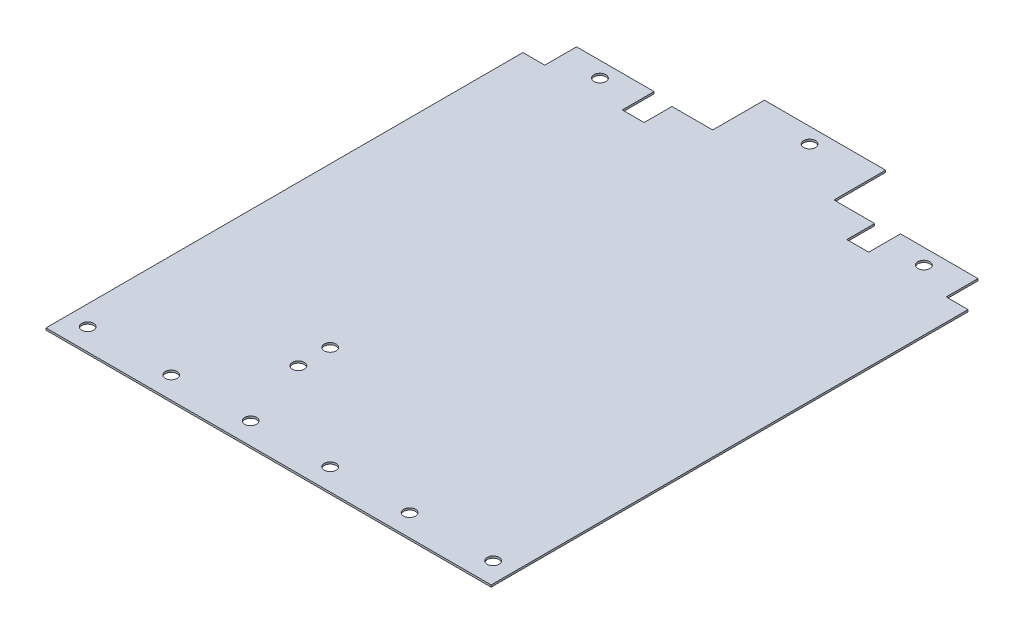
from build123d import *

# Parameters (mm, degrees)
CROQUIS1_W            = 112
CROQUIS1_H            = 140
BRIDA_BASE1_DEPTH     = 0.5
CORTAR_EXTRUIR1_DEPTH = 10
CROQUIS6_R            = 1.5
CORTAR_EXTRUIR2_DEPTH = 10
CROQUIS7_R            = 1.5
CORTAR_EXTRUIR3_DEPTH = 10


# Sheet-metal steps are written as plain solids
with BuildPart() as part:
    # Croquis1 → Brida base1 (new body)
    with BuildSketch(Plane(origin=(0, 0, 0), x_dir=(1, 0, 0), z_dir=(0, 1, 0))):
        Rectangle(CROQUIS1_W, CROQUIS1_H)
    extrude(amount=-BRIDA_BASE1_DEPTH)

    # Croquis5 → Cortar-Extruir1 (cut)
    with BuildSketch(Plane(origin=(0, 0, 0), x_dir=(1, 0, 0), z_dir=(0, 1, 0))):
        Polygon((-15.25, 57), (-15.25, 70), (-56, 70), (-56, 50), (-50.5, 50), (-50.5, 58), (-31, 58), (-31, 50), (-25.5, 50), (-25.5, 57), align=None)
        Polygon((56, 70), (15.25, 70), (15.25, 57), (25.5, 57), (25.5, 50), (31, 50), (31, 58), (50.5, 58), (50.5, 50), (56, 50), align=None)
    extrude(amount=-CORTAR_EXTRUIR1_DEPTH, mode=Mode.SUBTRACT)

    # Croquis6 → Cortar-Extruir2 (cut)
    with BuildSketch(Plane(origin=(0, 0, 0), x_dir=(1, 0, 0), z_dir=(0, 1, 0))):
        with Locations(Location((-40.75, 54.125, 0), (0, 0, 270))):
            Circle(CROQUIS6_R)
        with Locations(Location((0, 66.125, 0), (0, 0, 270))):
            Circle(CROQUIS6_R)
        with Locations(Location((40.75, 54.125, 0), (0, 0, 90))):
            Circle(CROQUIS6_R)
    extrude(amount=-CORTAR_EXTRUIR2_DEPTH, mode=Mode.SUBTRACT)

    # Croquis7 → Cortar-Extruir3 (cut)
    with BuildSketch(Plane(origin=(0, 0, 0), x_dir=(1, 0, 0), z_dir=(0, 1, 0))):
        with Locations(Location((-16, -38.5, 0), (0, 0, 270))):
            Circle(CROQUIS7_R)
        with Locations(Location((-16, -46.5, 0), (0, 0, 90))):
            Circle(CROQUIS7_R)
        with Locations(Location((-10, -64.5, 0), (0, 0, 270))):
            Circle(CROQUIS7_R)
        with Locations(Location((-30, -64.5, 0), (0, 0, 270))):
            Circle(CROQUIS7_R)
        with Locations(Location((30, -64.5, 0), (0, 0, 90))):
            Circle(CROQUIS7_R)
        with Locations(Location((10, -64.5, 0), (0, 0, 90))):
            Circle(CROQUIS7_R)
        with Locations(Location((-51, -64.5, 0), (0, 0, 270))):
            Circle(CROQUIS7_R)
        with Locations(Location((51, -64.5, 0), (0, 0, 90))):
            Circle(CROQUIS7_R)
    extrude(amount=-CORTAR_EXTRUIR3_DEPTH, mode=Mode.SUBTRACT)


solid = part.part
